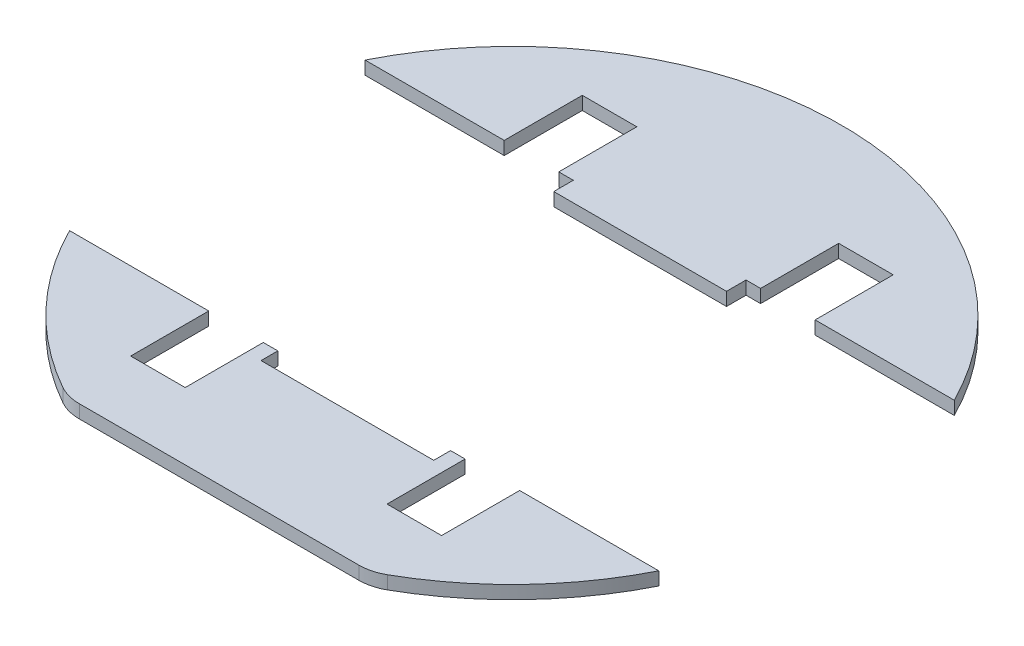
from build123d import *

# Parameters (mm, degrees)
BOSS_EXTRUDE1_DEPTH = 2.9
CUT_EXTRUDE1_DEPTH  = 103.571487266
SKETCH3_W           = 38.3
SKETCH3_H           = 65
CUT_EXTRUDE2_DEPTH  = 103.571487266


with BuildPart() as part:
    # Sketch1 → Boss-Extrude1 (new body)
    with BuildSketch(Plane(origin=(0, 0, 0), x_dir=(1, 0, 0), z_dir=(0, 1, 0))):
        with BuildLine():
            Line((-30.763446914, -64.404598464), (30.763446914, -64.404598464))
            ThreePointArc((30.763446914, -64.404598464), (33.308308644, -64.075362589), (35.68559842, -63.109334218))
            ThreePointArc((35.68559842, -63.109334218), (0, 72.5), (-35.68559842, -63.109334218))
            ThreePointArc((-35.68559842, -63.109334218), (-33.308308644, -64.075362589), (-30.763446914, -64.404598464))
        make_face()
    extrude(amount=BOSS_EXTRUDE1_DEPTH)

    # Sketch2 → Cut-Extrude1 (cut, through all)
    with BuildSketch(Plane(origin=(0, 2.9, 0), x_dir=(1, 0, 0), z_dir=(0, 1, 0))):
        Polygon((-34.2, 49.675685802), (-34.2, -49.675685802), (-22.2, -49.675685802), (-22.2, -32.5), (-19, -32.5), (-19, -36.2), (-18, -36.2), (18, -36.2), (19, -36.2), (19, -32.5), (22.2, -32.5), (22.2, -49.675685802), (34.2, -49.675685802), (34.2, 49.675685802), (22.2, 49.675685802), (22.2, 32.5), (19, 32.5), (19, 28.2), (-19, 28.2), (-19, 32.5), (-22.2, 32.5), (-22.2, 49.675685802), align=None)
    extrude(amount=-CUT_EXTRUDE1_DEPTH, mode=Mode.SUBTRACT)

    # Sketch3 → Cut-Extrude2 (cut, through all)
    with BuildSketch(Plane(origin=(0, 2.9, 0), x_dir=(1, 0, 0), z_dir=(0, 1, 0))):
        with Locations((-53.35, 0)):
            Rectangle(SKETCH3_W, SKETCH3_H)
        with Locations((53.35, 0)):
            Rectangle(SKETCH3_W, SKETCH3_H)
    extrude(amount=-CUT_EXTRUDE2_DEPTH, mode=Mode.SUBTRACT)


with BuildPart() as cut_extrude2_piece_1:
    # of the separate pieces the step leaves, piece 1, a body of its own (cut_extrude2_pieces)
    add(part.part.solids().sort_by_distance((64.807406984, 0, -32.5))[0])


with BuildPart() as cut_extrude2_piece_2:
    # of the separate pieces the step leaves, piece 2, a body of its own (cut_extrude2_pieces)
    add(part.part.solids().sort_by_distance((-35.68559842, 0, 63.109334218))[0])


solid = Compound([cut_extrude2_piece_1.part, cut_extrude2_piece_2.part])
